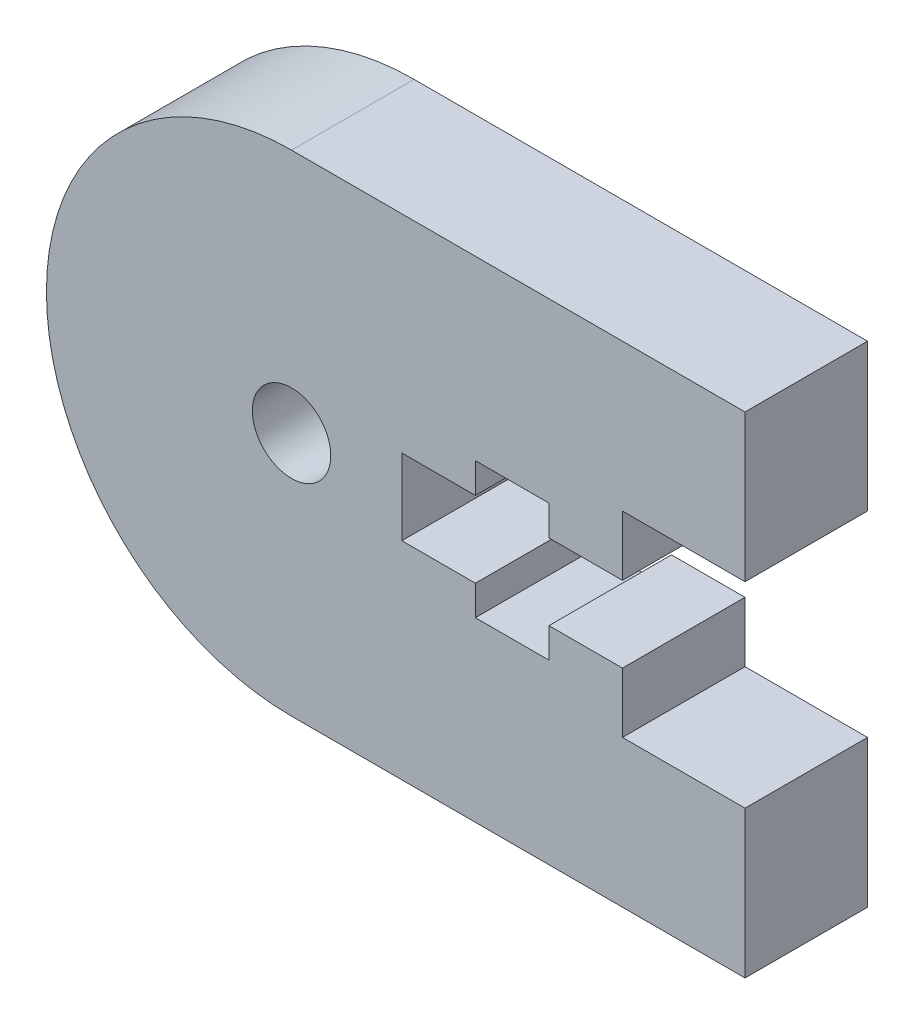
from build123d import *

# Parameters (mm, degrees)
BOSS_EXTRU_1_DEPTH              = 5
ESQUISSE2_W                     = 5
ESQUISSE2_H                     = 8
ENL_V_MAT_EXTRU_1_DEPTH         = 21.34699
ENL_V_START                     = -2.5
ENL_V_MAT_EXTRU_2_DEPTH         = 2.5
DIAM_TRE_DU_PER_AGE_2_5_2_5_2_D = 2.5
BOSS_EXTRU_2_START              = -5
BOSS_EXTRU_2_DEPTH              = 5
ESQUISSE10_R                    = 1.6
ENL_V_MAT_EXTRU_3_DEPTH         = 21.34699


with BuildPart() as part:
    # Esquisse1 → Boss.-Extru.1 (new body)
    with BuildSketch(Plane(origin=(0, 0, 0), x_dir=(-1, 0, 0), z_dir=(0, 0, -1))):
        with BuildLine():
            Line((-17, 10), (-17, -10))
            Line((-17, -10), (1.5, -10))
            ThreePointArc((1.5, -10), (11.5, 0), (1.5, 10))
            Line((1.5, 10), (-17, 10))
        make_face()
    extrude(amount=-BOSS_EXTRU_1_DEPTH)

    # Esquisse2 → Enlèv. mat.-Extru.1 (cut, through all)
    with BuildSketch(Plane.XY.offset(5)):
        with Locations((14.5, 0)):
            Rectangle(ESQUISSE2_W, ESQUISSE2_H)
    extrude(amount=-ENL_V_MAT_EXTRU_1_DEPTH, mode=Mode.SUBTRACT)

    # Esquisse3 → Enlèv. mat.-Extru.2 (cut)
    with BuildSketch(Plane.XY.offset(5).offset(ENL_V_START)):
        with BuildLine():
            Line((-10.160254, -5), (7, -5))
            Line((7, -5), (7, 5))
            Line((7, 5), (-10.160254, 5))
            ThreePointArc((-10.160254, 5), (-11.5, 0), (-10.160254, -5))
        make_face()
    extrude(amount=ENL_V_MAT_EXTRU_2_DEPTH, mode=Mode.SUBTRACT)

    # Diamètre du perçage Ø2.5 (2.5)2 (through all)
    with Locations(Plane.XY.offset(2.5)):
        with Locations((-1.5, 0)):
            Hole(DIAM_TRE_DU_PER_AGE_2_5_2_5_2_D / 2)

    # Esquisse9 → Boss.-Extru.2 (add)
    with BuildSketch(Plane.XY.offset(5).offset(BOSS_EXTRU_2_START)):
        with BuildLine():
            Line((-10.160254, -5), (7, -5))
            Line((7, -5), (7, 5))
            Line((7, 5), (-10.160254, 5))
            ThreePointArc((-10.160254, 5), (-11.5, 0), (-10.160254, -5))
        make_face()
    extrude(amount=BOSS_EXTRU_2_DEPTH)

    # Esquisse10 → Enlèv. mat.-Extru.3 (cut, through all)
    with BuildSketch(Plane.XY.offset(5)):
        Polygon((9, -1.55), (12, -1.55), (12, 1.55), (9, 1.55), (9, 2.78), (6, 2.78), (6, 1.55), (3, 1.55), (3, -1.55), (6, -1.55), (6, -2.77), (9, -2.77), align=None)
        with Locations((-1.5, 0)):
            Circle(ESQUISSE10_R)
    extrude(amount=-ENL_V_MAT_EXTRU_3_DEPTH, mode=Mode.SUBTRACT)


solid = part.part
